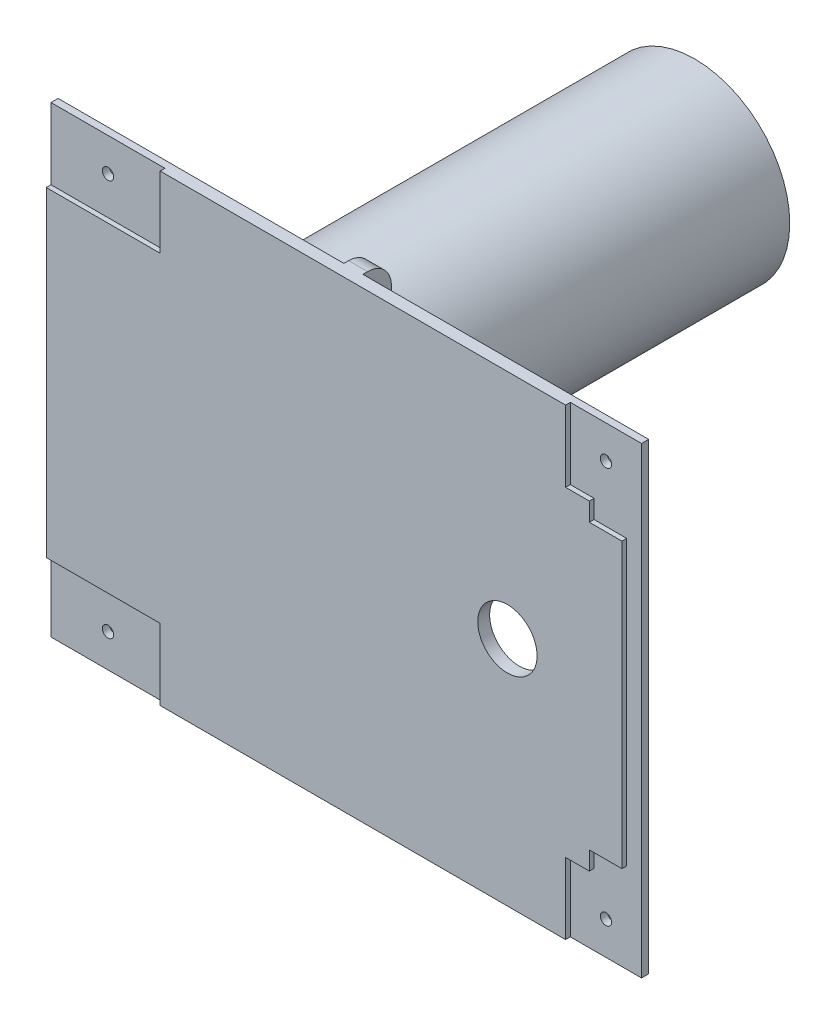
from build123d import *

# Parameters (mm, degrees)
CROQUIS1_W                 = 248.76
CROQUIS1_H                 = 195
SALIENTE_EXTRUIR1_DEPTH    = 5
CROQUIS2_W                 = 48
CROQUIS2_H                 = 30
CROQUIS2_W_2               = 30
CORTAR_EXTRUIR1_DEPTH      = 2
CROQUIS3_R                 = 2.375
CORTAR_EXTRUIR2_DEPTH      = 10
CROQUIS4_R                 = 40
SALIENTE_EXTRUIR2_DEPTH    = 206
CROQUIS5_R                 = 12.5
CORTAR_EXTRUIR3_DEPTH      = 10
CROQUIS12_W                = 12
CROQUIS12_H                = 30
SALIENTE_EXTRUIR3_DEPTH    = 4
REDONDEO1_R                = 10
REDONDEO2_R                = 10
REDONDEO3_R                = 10
CORTAR_EXTRUIR5_DEPTH      = 262.677217236
CORTAR_EXTRUIR5_DEPTH_BACK = 262.677217236
CROQUIS13_R                = 1.625
CORTAR_EXTRUIR7_DEPTH      = 2


with BuildPart() as part:
    # Croquis1 → Saliente-Extruir1 (new body)
    with BuildSketch(Plane.XY):
        with Locations((7.088293187, 0.26268)):
            Rectangle(CROQUIS1_W, CROQUIS1_H)
    extrude(amount=SALIENTE_EXTRUIR1_DEPTH)

    # Croquis2 → Cortar-Extruir1 (cut)
    with BuildSketch(Plane.XY.offset(5)):
        with Locations((-93.291706813, -82.23732)):
            Rectangle(CROQUIS2_W, CROQUIS2_H)
        with Locations((116.468293187, 82.76268)):
            Rectangle(CROQUIS2_W_2, CROQUIS2_H)
        with Locations((116.468293187, -82.23732)):
            Rectangle(CROQUIS2_W_2, CROQUIS2_H)
        with Locations((-93.291706813, 82.76268)):
            Rectangle(CROQUIS2_W, CROQUIS2_H)
    extrude(amount=-CORTAR_EXTRUIR1_DEPTH, mode=Mode.SUBTRACT)

    # Croquis3 → Cortar-Extruir2 (cut)
    with BuildSketch(Plane.XY.offset(5)):
        with Locations((-93.291706813, 83.76268)):
            Circle(CROQUIS3_R)
        with Locations((-93.291706813, -83.23732)):
            Circle(CROQUIS3_R)
        with Locations((116.468293187, 83.76268)):
            Circle(CROQUIS3_R)
        with Locations((116.468293187, -83.23732)):
            Circle(CROQUIS3_R)
    extrude(amount=-CORTAR_EXTRUIR2_DEPTH, mode=Mode.SUBTRACT)

    # Croquis4 → Saliente-Extruir2 (add)
    with BuildSketch(Plane(origin=(0, 0, 0), x_dir=(-1, 0, 0), z_dir=(0, 0, -1))):
        with Locations((55.101706813, 0.26268)):
            Circle(CROQUIS4_R)
    extrude(amount=SALIENTE_EXTRUIR2_DEPTH)

    # Croquis5 → Cortar-Extruir3 (cut)
    with BuildSketch(Plane(origin=(0, 0, 0), x_dir=(-1, 0, 0), z_dir=(0, 0, -1))):
        with Locations((-76.968293187, 0.26268)):
            Circle(CROQUIS5_R)
    extrude(amount=-CORTAR_EXTRUIR3_DEPTH, mode=Mode.SUBTRACT)

    # Croquis12 → Saliente-Extruir3 (add, symmetric)
    with BuildSketch(Plane(origin=(7.088293187, 0, 0), x_dir=(0, 0, -1), z_dir=(1, 0, 0))):
        with Locations((6, 82.76268)):
            Rectangle(CROQUIS12_W, CROQUIS12_H)
        with Locations((6, -82.23732)):
            Rectangle(CROQUIS12_W, CROQUIS12_H)
    extrude(amount=SALIENTE_EXTRUIR3_DEPTH, both=True)

    # Redondeo1
    redondeo1_edges = [part.edges().sort_by_distance(p)[0] for p in [
        (7.088293187, -67.23732, 0),
        (7.088293187, 67.76268, 0),
    ]]
    fillet(redondeo1_edges, radius=REDONDEO1_R)

    # Redondeo2
    redondeo2_edges = [part.edges().sort_by_distance(p)[0] for p in [
        (7.088293187, 67.76268, -12),
        (7.088293187, -67.23732, -12),
    ]]
    fillet(redondeo2_edges, radius=REDONDEO2_R)

    # Redondeo3
    redondeo3_edges = [part.edges().sort_by_distance(p)[0] for p in [
        (7.088293187, -97.23732, -12),
        (7.088293187, 97.76268, -12),
    ]]
    fillet(redondeo3_edges, radius=REDONDEO3_R)

    # Croquis13 → Cortar-Extruir5 (cut, two sides: drawn at the far end of the back side and taken through both)
    with BuildSketch(Plane(origin=(11.088293187, 0, 0), x_dir=(0, 0, -1), z_dir=(1, 0, 0)).offset(-CORTAR_EXTRUIR5_DEPTH_BACK)):
        with Locations((6, 87.76268)):
            Circle(CROQUIS13_R)
        with Locations((6, 77.76268)):
            Circle(CROQUIS13_R)
        with Locations((6, -77.23732)):
            Circle(CROQUIS13_R)
        with Locations((6, -87.23732)):
            Circle(CROQUIS13_R)
    extrude(amount=CORTAR_EXTRUIR5_DEPTH + CORTAR_EXTRUIR5_DEPTH_BACK, mode=Mode.SUBTRACT)

    # Croquis15 → Cortar-Extruir7 (cut)
    with BuildSketch(Plane.XY.offset(5)):
        Polygon((111.468293187, 67.76268), (131.468293187, 67.76268), (131.468293187, -67.23732), (111.468293187, -67.23732), (111.468293187, -59.48732), (125.218293187, -59.48732), (125.218293187, 60.01268), (111.468293187, 60.01268), align=None)
    extrude(amount=-CORTAR_EXTRUIR7_DEPTH, mode=Mode.SUBTRACT)


solid = part.part
